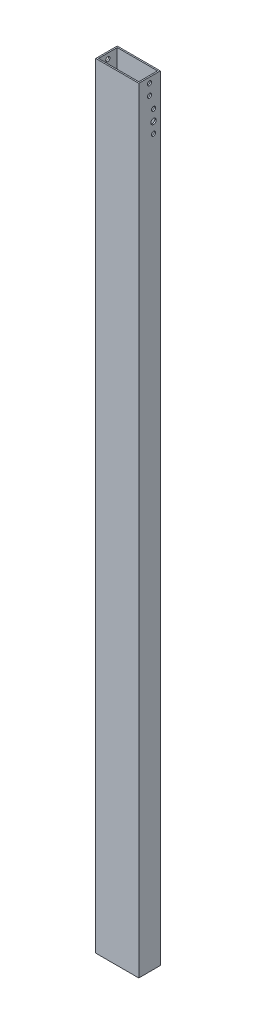
from build123d import *

# Parameters (mm, degrees)
SKETCH1_W               = 50.8
SKETCH1_H               = 914.4
BOSS_EXTRUDE1_DEPTH     = 12.7
SHELL1_T                = -1.5875
CUT_EXTRUDE1_DEPTH      = 459.081095441
CUT_EXTRUDE1_DEPTH_BACK = 459.081095441
SKETCH3_R               = 2.4892
CUT_EXTRUDE2_DEPTH      = 459.081095441
CUT_EXTRUDE2_DEPTH_BACK = 459.081095441
SKETCH4_R               = 3.175
SKETCH4_R_2             = 2.4892
SKETCH5_W               = 31.75
SKETCH5_H               = 26.9875
CUT_EXTRUDE3_DEPTH      = 459.081095441
FILLET1_R               = 3.175


with BuildPart() as part:
    # Sketch1 → Boss-Extrude1 (new, symmetric)
    with BuildSketch(Plane.XY):
        Rectangle(SKETCH1_W, SKETCH1_H)
    extrude(amount=BOSS_EXTRUDE1_DEPTH, both=True)

    # Shell1
    shell1_openings = [part.faces().sort_by_distance(p)[0] for p in [
        (0, -457.2, 0),
        (0, 457.2, 0),
    ]]
    offset(amount=SHELL1_T, openings=shell1_openings, kind=Kind.INTERSECTION)

    # Sketch3 → Cut-Extrude1 (cut, two sides: drawn at the far end of the back side and taken through both)
    with BuildSketch(Plane(origin=(0, 0, 0), x_dir=(0, 0, -1), z_dir=(1, 0, 0)).offset(-CUT_EXTRUDE1_DEPTH_BACK)):
        with Locations((0, 438.15)):
            Circle(SKETCH3_R)
        with Locations((0, 450.85)):
            Circle(SKETCH3_R)
    extrude(amount=CUT_EXTRUDE1_DEPTH + CUT_EXTRUDE1_DEPTH_BACK, mode=Mode.SUBTRACT)

    # Sketch4 → Cut-Extrude2 (cut, two sides: drawn at the far end of the back side and taken through both)
    with BuildSketch(Plane(origin=(0, 0, 0), x_dir=(0, 0, -1), z_dir=(1, 0, 0)).offset(-CUT_EXTRUDE2_DEPTH_BACK)):
        with Locations((4.7625, 409.575)):
            Circle(SKETCH4_R)
        with Locations((4.7625, 422.275)):
            Circle(SKETCH4_R_2)
        with Locations((4.7625, 396.875)):
            Circle(SKETCH4_R_2)
    extrude(amount=CUT_EXTRUDE2_DEPTH + CUT_EXTRUDE2_DEPTH_BACK, mode=Mode.SUBTRACT)

    # Sketch5 → Cut-Extrude3 (cut, through all)
    with BuildSketch(Plane.XY):
        with Locations((0, 409.575)):
            Rectangle(SKETCH5_W, SKETCH5_H)
    extrude(amount=-CUT_EXTRUDE3_DEPTH, mode=Mode.SUBTRACT)

    # Fillet1
    fillet1_edges = [part.edges().sort_by_distance(p)[0] for p in [
        (15.875, 423.06875, -11.90625),
        (15.875, 396.08125, -11.90625),
        (-15.875, 396.08125, -11.90625),
        (-15.875, 423.06875, -11.90625),
    ]]
    fillet(fillet1_edges, radius=FILLET1_R)


solid = part.part
